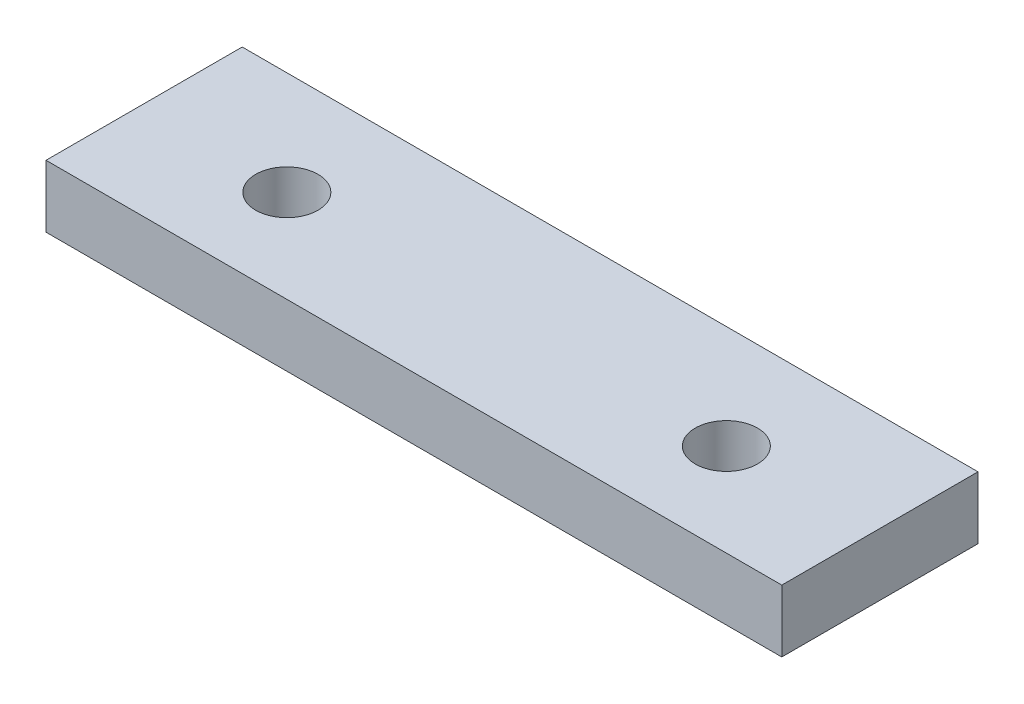
from build123d import *

# Parameters (mm, degrees)
SKETCH1_W           = 40
SKETCH1_H           = 12.7
BOSS_EXTRUDE1_DEPTH = 150
CUT_EXTRUDE1_REACH  = 157.76
SKETCH2_R           = 6.35


with BuildPart() as part:
    # Sketch1 → Boss-Extrude1 (new body)
    with BuildSketch(Plane(origin=(0, 0, 0), x_dir=(0, 0, -1), z_dir=(1, 0, 0))):
        with Locations((20, 6.35)):
            Rectangle(SKETCH1_W, SKETCH1_H)
    extrude(amount=BOSS_EXTRUDE1_DEPTH)

    # Sketch2 → Cut-Extrude1 (cut, up to next)
    with BuildSketch(Plane(origin=(0, 12.7, 0), x_dir=(1, 0, 0), z_dir=(0, 1, 0)), mode=Mode.PRIVATE) as cut_extrude1_sk1:
        with Locations((30.2, 18.9)):
            Circle(SKETCH2_R)
    cut_extrude1_tool1 = extrude(cut_extrude1_sk1.sketch, amount=-CUT_EXTRUDE1_REACH, mode=Mode.PRIVATE) & part.part
    # Sketch2 → Cut-Extrude1 (cut, up to next)
    with BuildSketch(Plane(origin=(0, 12.7, 0), x_dir=(1, 0, 0), z_dir=(0, 1, 0)), mode=Mode.PRIVATE) as cut_extrude1_sk2:
        with Locations((119.8, 18.9)):
            Circle(SKETCH2_R)
    cut_extrude1_tool2 = extrude(cut_extrude1_sk2.sketch, amount=-CUT_EXTRUDE1_REACH, mode=Mode.PRIVATE) & part.part
    add(cut_extrude1_tool1.solids().sort_by_distance((30.2, 12.7, -18.9))[0], mode=Mode.SUBTRACT)
    add(cut_extrude1_tool2.solids().sort_by_distance((119.8, 12.7, -18.9))[0], mode=Mode.SUBTRACT)


solid = part.part
